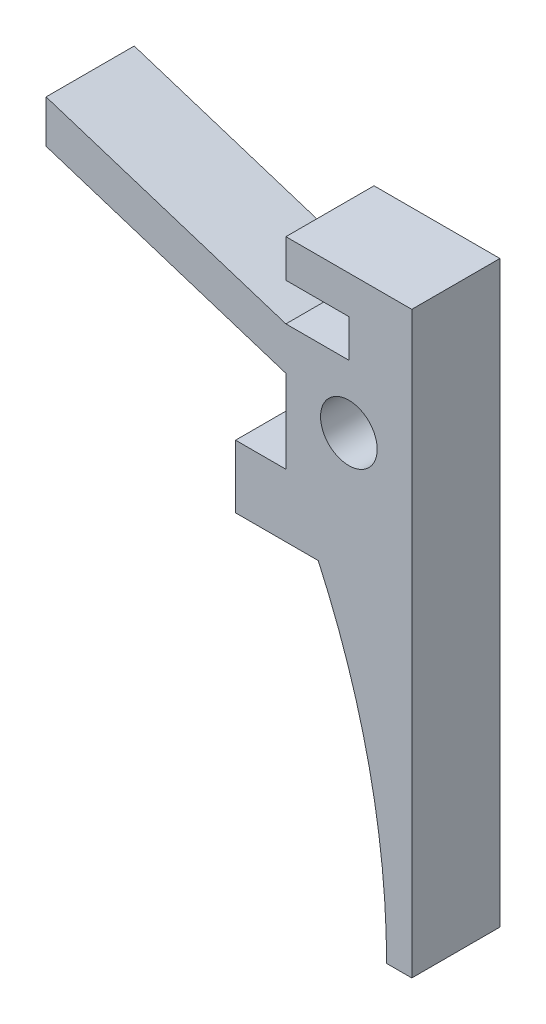
from build123d import *

# Parameters (mm, degrees)
CROQUIS1_R              = 2.25
SALIENTE_EXTRUIR1_DEPTH = 7
CROQUIS5_W              = 5
CROQUIS5_H              = 7
SALIENTE_EXTRUIR3_DEPTH = 3
CROQUIS6_W              = 10
CROQUIS6_H              = 7
SALIENTE_EXTRUIR4_DEPTH = 3


with BuildPart() as part:
    # Croquis1 → Saliente-Extruir1 (new body)
    with BuildSketch(Plane.XY):
        with BuildLine():
            Line((-5, 5), (5, 5))
            Line((5, 5), (5, -5))
            Line((5, -5), (5, -35))
            Line((5, -35), (3, -35))
            ThreePointArc((3, -35), (1.626455966, -22.208384274), (-2.431549639, -10))
            Line((-2.431549639, -10), (-9, -10))
            Line((-9, -10), (-9, -5))
            Line((-9, -5), (-5, -5))
            Line((-5, -5), (-5, 1.598929296))
            Line((-5, 1.598929296), (-24.04966671, 7.690743333))
            Line((-24.04966671, 7.690743333), (-24.04966671, 11.091814036))
            Line((-24.04966671, 11.091814036), (-5, 5))
        make_face()
        Circle(CROQUIS1_R, mode=Mode.SUBTRACT)
    extrude(amount=SALIENTE_EXTRUIR1_DEPTH)

    # Croquis5 → Saliente-Extruir3 (add)
    with BuildSketch(Plane(origin=(0, 5, 0), x_dir=(1, 0, 0), z_dir=(0, 1, 0))):
        with Locations((2.5, -3.5)):
            Rectangle(CROQUIS5_W, CROQUIS5_H)
    extrude(amount=SALIENTE_EXTRUIR3_DEPTH)

    # Croquis6 → Saliente-Extruir4 (add)
    with BuildSketch(Plane(origin=(0, 8, 0), x_dir=(1, 0, 0), z_dir=(0, 1, 0))):
        with Locations((0, -3.5)):
            Rectangle(CROQUIS6_W, CROQUIS6_H)
    extrude(amount=SALIENTE_EXTRUIR4_DEPTH)


solid = part.part
